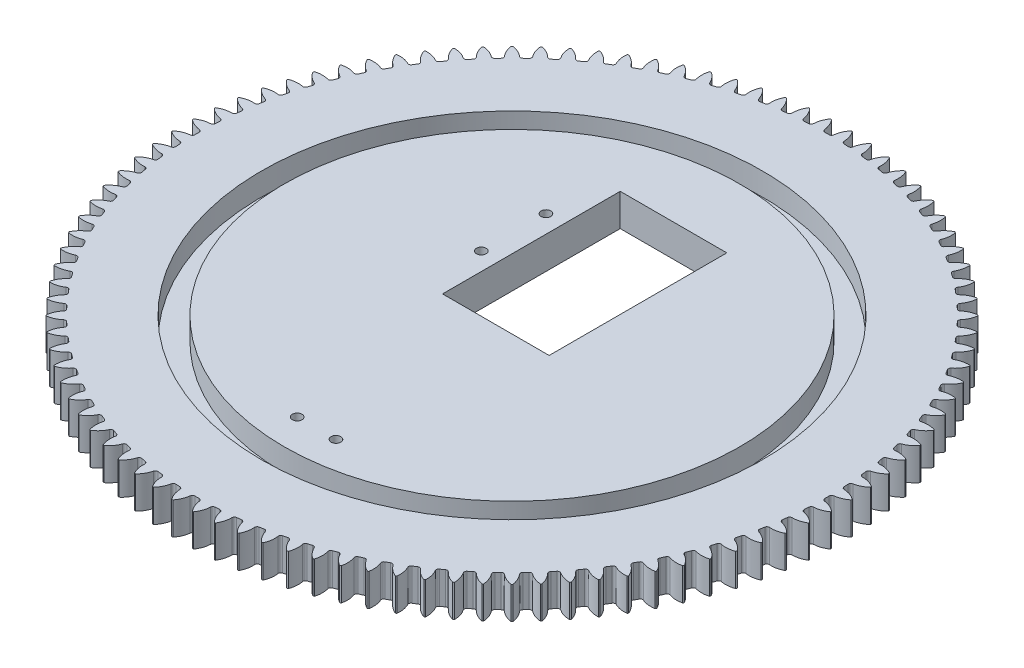
from build123d import *

# Parameters (mm, degrees)
SKETCH1_R                = 102
BOSS_EXTRUDE1_DEPTH      = 10
CUT_EXTRUDE1_DEPTH       = 145.595988879
FILLET1_R                = 0.76
CIRPATTERN2_COUNT        = 100
FILLET1_OF_CIRPATTERN2_R = 0.76
SKETCH3_R                = 77.5
SKETCH3_R_2              = 70.5
CUT_EXTRUDE2_DEPTH       = 7
SKETCH6_W                = 33
SKETCH6_H                = 55
CUT_EXTRUDE3_DEPTH       = 145.533117456
SKETCH7_W                = 42
SKETCH7_H                = 47
SKETCH7_R                = 11.5
SKETCH7_R_2              = 1.5
BOSS_EXTRUDE2_DEPTH      = 5
SKETCH9_W                = 42
SKETCH9_H                = 42
BOSS_EXTRUDE3_DEPTH      = 5
SKETCH10_R               = 1.5
CUT_EXTRUDE4_DEPTH       = 152.65362521
SKETCH11_R               = 1.5
CUT_EXTRUDE5_DEPTH       = 152.65362521


with BuildPart() as part:
    # Sketch1 → Boss-Extrude1 (new body)
    with BuildSketch(Plane(origin=(0, 0, 0), x_dir=(1, 0, 0), z_dir=(0, 1, 0))):
        Circle(SKETCH1_R)
    extrude(amount=BOSS_EXTRUDE1_DEPTH)

    # Sketch2 → Cut-Extrude1 (cut, through all)
    with BuildSketch(Plane(origin=(0, 10, 0), x_dir=(1, 0, 0), z_dir=(0, 1, 0))):
        with BuildLine():
            ThreePointArc((1.389546622, 97.490097755), (0, 97.5), (-1.389546622, 97.490097755))
            ThreePointArc((-1.389546622, 97.490097755), (-1.824876583, 99.860091271), (-3.014796953, 101.95543634))
            ThreePointArc((-3.014796953, 101.95543634), (0, 102), (3.014796953, 101.95543634))
            ThreePointArc((3.014796953, 101.95543634), (1.824876583, 99.860091271), (1.389546622, 97.490097755))
        make_face()
    cut_extrude1 = extrude(amount=-CUT_EXTRUDE1_DEPTH, mode=Mode.SUBTRACT)

    # Fillet1
    fillet1_edges = [part.edges().sort_by_distance(p)[0] for p in [
        (1.389546622, 5, -97.490097755),
        (-1.389546622, 5, -97.490097755),
    ]]
    fillet(fillet1_edges, radius=FILLET1_R)

    # CirPattern2: Cut-Extrude1 ×100 about axis
    cirpattern2_axis = Axis((0, 10, 0), (0, 1, 0))
    for i in range(1, CIRPATTERN2_COUNT):
        add(cut_extrude1.rotate(cirpattern2_axis, i * 360 / CIRPATTERN2_COUNT), mode=Mode.SUBTRACT)

    # Fillet1 of CirPattern2
    fillet1_of_cirpattern2_edges = [part.edges().sort_by_distance(p)[0] for p in [
        (-4.734649218, 5, -97.38497367),
        (-7.508258556, 5, -97.210472962),
        (-10.840159561, 5, -96.895515586),
        (-13.597338824, 5, -96.547202844),
        (-16.902888746, 5, -96.023655169),
        (-19.632756607, 5, -95.502905024),
        (-22.898909951, 5, -94.772833254),
        (-25.59069287, 5, -94.081700869),
        (-28.80455962, 5, -93.147986264),
        (-31.447634359, 5, -92.289199223),
        (-34.596530852, 5, -91.155526728),
        (-37.180466402, 5, -90.132474271),
        (-40.251965383, 5, -88.803317972),
        (-42.766564131, 5, -87.62003762),
        (-45.748543795, 5, -86.100643091),
        (-48.183881769, 5, -84.76180471),
        (-51.064573605, 5, -83.058168307),
        (-53.411039638, 5, -81.569055681),
        (-56.179074873, 5, -79.687900878),
        (-58.427408536, 5, -78.054390855),
        (-61.071862998, 5, -76.003141711),
        (-63.213191145, 5, -74.231681008),
        (-65.723628381, 5, -72.018432866),
        (-67.749500168, 5, -70.116012629),
        (-70.116012629, 5, -67.749500168),
        (-72.018432866, 5, -65.723628381),
        (-74.231681008, 5, -63.213191145),
        (-76.003141711, 5, -61.071862998),
        (-78.054390855, 5, -58.427408536),
        (-79.687900878, 5, -56.179074873),
        (-81.569055681, 5, -53.411039638),
        (-83.058168307, 5, -51.064573605),
        (-84.76180471, 5, -48.183881769),
        (-86.100643091, 5, -45.748543795),
        (-87.62003762, 5, -42.766564131),
        (-88.803317972, 5, -40.251965383),
        (-90.132474271, 5, -37.180466402),
        (-91.155526728, 5, -34.596530852),
        (-92.289199223, 5, -31.447634359),
        (-93.147986264, 5, -28.80455962),
        (-94.081700869, 5, -25.59069287),
        (-94.772833254, 5, -22.898909951),
        (-95.502905024, 5, -19.632756607),
        (-96.023655169, 5, -16.902888746),
        (-96.547202844, 5, -13.597338824),
        (-96.895515586, 5, -10.840159561),
        (-97.210472962, 5, -7.508258556),
        (-97.38497367, 5, -4.734649218),
        (-97.490097755, 5, -1.389546622),
        (-97.490097755, 5, 1.389546622),
        (-97.38497367, 5, 4.734649218),
        (-97.210472962, 5, 7.508258556),
        (-96.895515586, 5, 10.840159561),
        (-96.547202844, 5, 13.597338824),
        (-96.023655169, 5, 16.902888746),
        (-95.502905024, 5, 19.632756607),
        (-94.772833254, 5, 22.898909951),
        (-94.081700869, 5, 25.59069287),
        (-93.147986264, 5, 28.80455962),
        (-92.289199223, 5, 31.447634359),
        (-91.155526728, 5, 34.596530852),
        (-90.132474271, 5, 37.180466402),
        (-88.803317972, 5, 40.251965383),
        (-87.62003762, 5, 42.766564131),
        (-86.100643091, 5, 45.748543795),
        (-84.76180471, 5, 48.183881769),
        (-83.058168307, 5, 51.064573605),
        (-81.569055681, 5, 53.411039638),
        (-79.687900878, 5, 56.179074873),
        (-78.054390855, 5, 58.427408536),
        (-76.003141711, 5, 61.071862998),
        (-74.231681008, 5, 63.213191145),
        (-72.018432866, 5, 65.723628381),
        (-70.116012629, 5, 67.749500168),
        (-67.749500168, 5, 70.116012629),
        (-65.723628381, 5, 72.018432866),
        (-63.213191145, 5, 74.231681008),
        (-61.071862998, 5, 76.003141711),
        (-58.427408536, 5, 78.054390855),
        (-56.179074873, 5, 79.687900878),
        (-53.411039638, 5, 81.569055681),
        (-51.064573605, 5, 83.058168307),
        (-48.183881769, 5, 84.76180471),
        (-45.748543795, 5, 86.100643091),
        (-42.766564131, 5, 87.62003762),
        (-40.251965383, 5, 88.803317972),
        (-37.180466402, 5, 90.132474271),
        (-34.596530852, 5, 91.155526728),
        (-31.447634359, 5, 92.289199223),
        (-28.80455962, 5, 93.147986264),
        (-25.59069287, 5, 94.081700869),
        (-22.898909951, 5, 94.772833254),
        (-19.632756607, 5, 95.502905024),
        (-16.902888746, 5, 96.023655169),
        (-13.597338824, 5, 96.547202844),
        (-10.840159561, 5, 96.895515586),
        (-7.508258556, 5, 97.210472962),
        (-4.734649218, 5, 97.38497367),
        (-1.389546622, 5, 97.490097755),
        (1.389546622, 5, 97.490097755),
        (4.734649218, 5, 97.38497367),
        (7.508258556, 5, 97.210472962),
        (10.840159561, 5, 96.895515586),
        (13.597338824, 5, 96.547202844),
        (16.902888746, 5, 96.023655169),
        (19.632756607, 5, 95.502905024),
        (22.898909951, 5, 94.772833254),
        (25.59069287, 5, 94.081700869),
        (28.80455962, 5, 93.147986264),
        (31.447634359, 5, 92.289199223),
        (34.596530852, 5, 91.155526728),
        (37.180466402, 5, 90.132474271),
        (40.251965383, 5, 88.803317972),
        (42.766564131, 5, 87.62003762),
        (45.748543795, 5, 86.100643091),
        (48.183881769, 5, 84.76180471),
        (51.064573605, 5, 83.058168307),
        (53.411039638, 5, 81.569055681),
        (56.179074873, 5, 79.687900878),
        (58.427408536, 5, 78.054390855),
        (61.071862998, 5, 76.003141711),
        (63.213191145, 5, 74.231681008),
        (65.723628381, 5, 72.018432866),
        (67.749500168, 5, 70.116012629),
        (70.116012629, 5, 67.749500168),
        (72.018432866, 5, 65.723628381),
        (74.231681008, 5, 63.213191145),
        (76.003141711, 5, 61.071862998),
        (78.054390855, 5, 58.427408536),
        (79.687900878, 5, 56.179074873),
        (81.569055681, 5, 53.411039638),
        (83.058168307, 5, 51.064573605),
        (84.76180471, 5, 48.183881769),
        (86.100643091, 5, 45.748543795),
        (87.62003762, 5, 42.766564131),
        (88.803317972, 5, 40.251965383),
        (90.132474271, 5, 37.180466402),
        (91.155526728, 5, 34.596530852),
        (92.289199223, 5, 31.447634359),
        (93.147986264, 5, 28.80455962),
        (94.081700869, 5, 25.59069287),
        (94.772833254, 5, 22.898909951),
        (95.502905024, 5, 19.632756607),
        (96.023655169, 5, 16.902888746),
        (96.547202844, 5, 13.597338824),
        (96.895515586, 5, 10.840159561),
        (97.210472962, 5, 7.508258556),
        (97.38497367, 5, 4.734649218),
        (97.490097755, 5, 1.389546622),
        (97.490097755, 5, -1.389546622),
        (97.38497367, 5, -4.734649218),
        (97.210472962, 5, -7.508258556),
        (96.895515586, 5, -10.840159561),
        (96.547202844, 5, -13.597338824),
        (96.023655169, 5, -16.902888746),
        (95.502905024, 5, -19.632756607),
        (94.772833254, 5, -22.898909951),
        (94.081700869, 5, -25.59069287),
        (93.147986264, 5, -28.80455962),
        (92.289199223, 5, -31.447634359),
        (91.155526728, 5, -34.596530852),
        (90.132474271, 5, -37.180466402),
        (88.803317972, 5, -40.251965383),
        (87.62003762, 5, -42.766564131),
        (86.100643091, 5, -45.748543795),
        (84.76180471, 5, -48.183881769),
        (83.058168307, 5, -51.064573605),
        (81.569055681, 5, -53.411039638),
        (79.687900878, 5, -56.179074873),
        (78.054390855, 5, -58.427408536),
        (76.003141711, 5, -61.071862998),
        (74.231681008, 5, -63.213191145),
        (72.018432866, 5, -65.723628381),
        (70.116012629, 5, -67.749500168),
        (67.749500168, 5, -70.116012629),
        (65.723628381, 5, -72.018432866),
        (63.213191145, 5, -74.231681008),
        (61.071862998, 5, -76.003141711),
        (58.427408536, 5, -78.054390855),
        (56.179074873, 5, -79.687900878),
        (53.411039638, 5, -81.569055681),
        (51.064573605, 5, -83.058168307),
        (48.183881769, 5, -84.76180471),
        (45.748543795, 5, -86.100643091),
        (42.766564131, 5, -87.62003762),
        (40.251965383, 5, -88.803317972),
        (37.180466402, 5, -90.132474271),
        (34.596530852, 5, -91.155526728),
        (31.447634359, 5, -92.289199223),
        (28.80455962, 5, -93.147986264),
        (25.59069287, 5, -94.081700869),
        (22.898909951, 5, -94.772833254),
        (19.632756607, 5, -95.502905024),
        (16.902888746, 5, -96.023655169),
        (13.597338824, 5, -96.547202844),
        (10.840159561, 5, -96.895515586),
        (7.508258556, 5, -97.210472962),
        (4.734649218, 5, -97.38497367),
    ]]
    fillet(fillet1_of_cirpattern2_edges, radius=FILLET1_OF_CIRPATTERN2_R)

    # Sketch3 → Cut-Extrude2 (cut)
    with BuildSketch(Plane(origin=(0, 10, 0), x_dir=(1, 0, 0), z_dir=(0, 1, 0))):
        Circle(SKETCH3_R)
        Circle(SKETCH3_R_2, mode=Mode.SUBTRACT)
    extrude(amount=-CUT_EXTRUDE2_DEPTH, mode=Mode.SUBTRACT)

    # Sketch6 → Cut-Extrude3 (cut, through all)
    with BuildSketch(Plane.XZ):
        with Locations((0, -22.5)):
            Rectangle(SKETCH6_W, SKETCH6_H)
    extrude(amount=-CUT_EXTRUDE3_DEPTH, mode=Mode.SUBTRACT)

    # Sketch7 → Boss-Extrude2 (add)
    with BuildSketch(Plane(origin=(21.5, 0, 0), x_dir=(0, 0, -1), z_dir=(1, 0, 0))):
        with Locations((22.5, -23.5)):
            Rectangle(SKETCH7_W, SKETCH7_H)
        with Locations((22.5, -26)):
            Circle(SKETCH7_R, mode=Mode.SUBTRACT)
        with Locations((7, -10.5)):
            Circle(SKETCH7_R_2, mode=Mode.SUBTRACT)
        with Locations((38, -10.5)):
            Circle(SKETCH7_R_2, mode=Mode.SUBTRACT)
        with Locations((38, -41.5)):
            Circle(SKETCH7_R_2, mode=Mode.SUBTRACT)
        with Locations((7, -41.5)):
            Circle(SKETCH7_R_2, mode=Mode.SUBTRACT)
    extrude(amount=BOSS_EXTRUDE2_DEPTH)

    # Sketch9 → Boss-Extrude3 (add)
    with BuildSketch(Plane.XZ):
        with Locations((47.5, -22.5)):
            Rectangle(SKETCH9_W, SKETCH9_H)
    extrude(amount=BOSS_EXTRUDE3_DEPTH)

    # Sketch10 → Cut-Extrude4 (cut, through all)
    with BuildSketch(Plane.XZ):
        with Locations((-6, 60.5)):
            Circle(SKETCH10_R)
        with Locations((6, 60.5)):
            Circle(SKETCH10_R)
    extrude(amount=-CUT_EXTRUDE4_DEPTH, mode=Mode.SUBTRACT)

    # Sketch11 → Cut-Extrude5 (cut, through all)
    with BuildSketch(Plane.XZ):
        with Locations((-22, -12.5)):
            Circle(SKETCH11_R)
        with Locations((-22, -32.5)):
            Circle(SKETCH11_R)
    extrude(amount=-CUT_EXTRUDE5_DEPTH, mode=Mode.SUBTRACT)


solid = part.part
